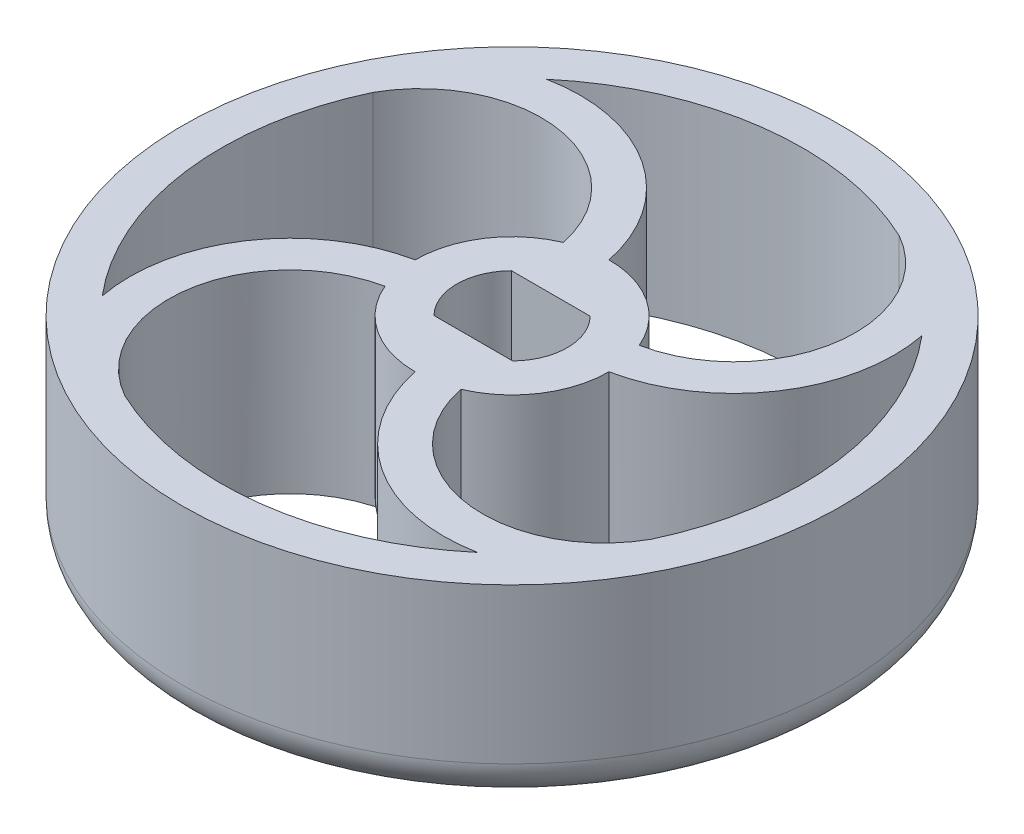
from build123d import *

# Parameters (mm, degrees)
SKETCH1_R           = 17
SKETCH1_R_2         = 14.999999999999998
BOSS_EXTRUDE1_DEPTH = 10
SKETCH2_R           = 5
BOSS_EXTRUDE2_DEPTH = 10
BOSS_EXTRUDE3_START = -10
BOSS_EXTRUDE3_DEPTH = 10
FILLET1_R           = 2
BOSS_EXTRUDE4_START = -2
BOSS_EXTRUDE4_DEPTH = 2
FILLET2_R           = 2
CUT_EXTRUDE1_DEPTH  = 8


with BuildPart() as part:
    # Sketch1 → Boss-Extrude1 (new body)
    with BuildSketch(Plane(origin=(0, 0, 0), x_dir=(1, 0, 0), z_dir=(0, 1, 0))):
        with Locations(Location((0, 0, 0), (0, 0, 270))):
            Circle(SKETCH1_R)
        with Locations(Location((0, 0, 0), (0, 0, 270))):
            Circle(SKETCH1_R_2, mode=Mode.SUBTRACT)
    extrude(amount=BOSS_EXTRUDE1_DEPTH)



with BuildPart() as body_2:
    # Sketch2 → Boss-Extrude2 (new body)
    with BuildSketch(Plane(origin=(0, 10, 0), x_dir=(1, 0, 0), z_dir=(0, 1, 0))):
        with Locations(Location((0, 0, 0), (0, 0, 270))):
            Circle(SKETCH2_R)
        with BuildLine():
            Line((-1.9448650338776723, 1.8000000000000003), (1.9448650338776723, 1.8000000000000003))
            ThreePointArc((1.9448650338776723, 1.8000000000000003), (2.65, 2.9e-16), (1.9448650338776725, -1.8))
            Line((1.9448650338776725, -1.8), (-1.9448650338776725, -1.8))
            ThreePointArc((-1.9448650338776725, -1.8), (-2.65, 3.2e-16), (-1.9448650338776723, 1.8000000000000003))
        make_face(mode=Mode.SUBTRACT)
    extrude(amount=-BOSS_EXTRUDE2_DEPTH)


with BuildPart() as part_1:
    add(part.part)

    add(body_2.part)  # Boss-Extrude3 merges body 2
    # Sketch3 → Boss-Extrude3 (add)
    with BuildSketch(Plane(origin=(0, 10, 0), x_dir=(1, 0, 0), z_dir=(0, 1, 0)).offset(BOSS_EXTRUDE3_START)):
        with BuildLine():
            ThreePointArc((-13.566134305689296, 6.4), (-7.136792678521299, 9.536951322914675), (-1.9595917942265426, 4.6000000000000005))
            ThreePointArc((-1.9595917942265426, 4.6000000000000005), (-1.0000000000000004, 4.898979485566357), (0, 5.000000000000001))
            ThreePointArc((0, 5.000000000000001), (-3.511067317848477, 10.221869444049297), (-9.681023203858528, 11.457652016288186))
            ThreePointArc((-9.681023203858528, 11.457652016288186), (-11.895484187198832, 9.137694236080705), (-13.566134305689296, 6.4))
        make_face()
        with BuildLine():
            ThreePointArc((6.400000000000048, 13.566134305689273), (9.5369513229147, 7.1367926785212665), (4.600000000000008, 1.9595917942265266))
            ThreePointArc((4.600000000000008, 1.9595917942265266), (4.898979485566361, 0.9999999999999829), (5.000000000000001, -1.746e-14))
            ThreePointArc((5.000000000000001, -1.746e-14), (10.221869444049313, 3.5110673178484406), (11.45765201628822, 9.681023203858487))
            ThreePointArc((11.45765201628822, 9.681023203858487), (9.137694236080746, 11.895484187198797), (6.400000000000048, 13.566134305689273))
        make_face()
        with BuildLine():
            ThreePointArc((13.56613430568925, -6.4000000000000945), (7.136792678521233, -9.536951322914723), (1.9595917942265106, -4.600000000000015))
            ThreePointArc((1.9595917942265106, -4.600000000000015), (0.9999999999999661, -4.898979485566364), (-3.491e-14, -5.000000000000001))
            ThreePointArc((-3.491e-14, -5.000000000000001), (3.511067317848407, -10.221869444049325), (9.681023203858448, -11.457652016288254))
            ThreePointArc((9.681023203858448, -11.457652016288254), (11.895484187198766, -9.137694236080788), (13.56613430568925, -6.4000000000000945))
        make_face()
        with BuildLine():
            ThreePointArc((-6.4000000000001425, -13.566134305689229), (-9.53695132291475, -7.1367926785212), (-4.600000000000022, -1.9595917942264942))
            ThreePointArc((-4.600000000000022, -1.9595917942264942), (-4.898979485566368, -0.9999999999999478), (-5.000000000000001, 5.281e-14))
            ThreePointArc((-5.000000000000001, 5.281e-14), (-10.221869444049336, -3.5110673178483705), (-11.457652016288288, -9.681023203858407))
            ThreePointArc((-11.457652016288288, -9.681023203858407), (-9.13769423608083, -11.895484187198734), (-6.4000000000001425, -13.566134305689229))
        make_face()
    extrude(amount=BOSS_EXTRUDE3_DEPTH)

    # Fillet1
    fillet1_edges = [part_1.edges().sort_by_distance(p)[0] for p in [
        (5.2e-15, 0, -17),
    ]]
    fillet(fillet1_edges, radius=FILLET1_R - 0.0001)  # a hair under: the kernel refuses the full size

    # Sketch4 → Boss-Extrude4 (add)
    with BuildSketch(Plane.XZ.offset(BOSS_EXTRUDE4_START)):
        with BuildLine():
            Line((-1.9448650338776725, 1.8), (1.9448650338776725, 1.8))
            ThreePointArc((1.9448650338776725, 1.8), (2.65, 0), (1.9448650338776723, -1.8000000000000003))
            Line((1.9448650338776723, -1.8000000000000003), (-1.9448650338776723, -1.8000000000000003))
            ThreePointArc((-1.9448650338776723, -1.8000000000000003), (-2.65, 3.2e-16), (-1.9448650338776725, 1.8))
        make_face()
    extrude(amount=BOSS_EXTRUDE4_DEPTH)

    # Fillet2
    fillet2_edges = [part_1.edges().sort_by_distance(p)[0] for p in [
        (-4.171208396324286, 0, -2.7569948339512305),
        (2.7569948339512154, 0, -4.171208396324297),
        (4.171208396324286, 0, 2.7569948339512305),
        (-2.7569948339512305, 0, 4.171208396324286),
    ]]
    fillet(fillet2_edges, radius=FILLET2_R)

    # Sketch5 → Cut-Extrude1 (cut)
    with BuildSketch(Plane(origin=(0, 10, 0), x_dir=(1, 0, 0), z_dir=(0, 1, 0))):
        with BuildLine():
            Line((-2.030394050424718, -2), (2.0303940504247175, -2.0000000000000004))
            ThreePointArc((2.0303940504247175, -2.0000000000000004), (2.850000000000016, -3.2e-16), (2.030394050424718, 2))
            Line((2.030394050424718, 2), (-2.030394050424718, 2))
            ThreePointArc((-2.030394050424718, 2), (-2.850000000000016, 3.5e-16), (-2.030394050424718, -2))
        make_face()
    extrude(amount=-CUT_EXTRUDE1_DEPTH, mode=Mode.SUBTRACT)


solid = part_1.part
